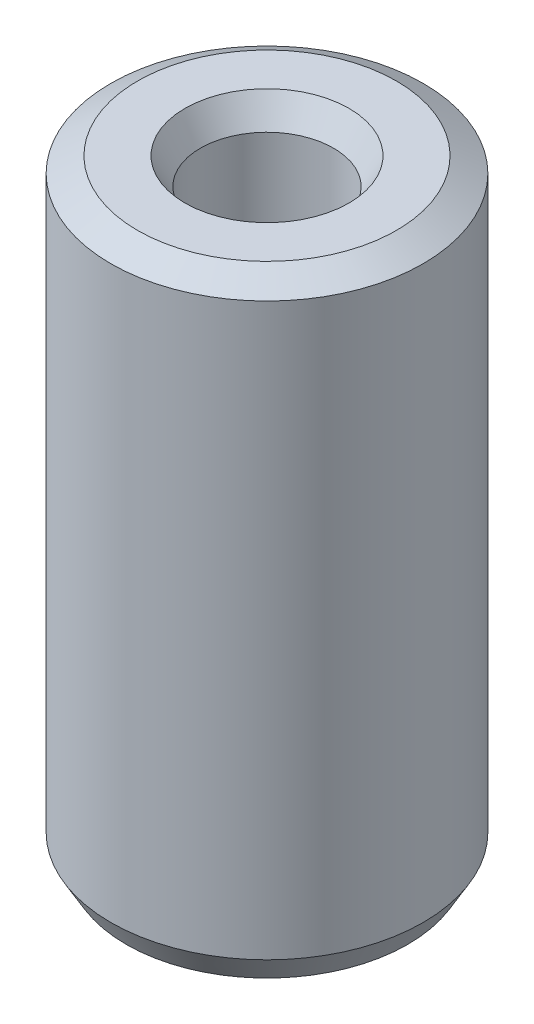
from build123d import *
from OCP.BRepFilletAPI import BRepFilletAPI_MakeChamfer

# Parameters (mm, degrees)
SKETCH1_R           = 10
BOSS_EXTRUDE1_DEPTH = 39.22732465
SKETCH2_R           = 4.26370812
CUT_EXTRUDE1_DEPTH  = 42.698716997
CHAMFER1_SIZE       = 0.988595411
CHAMFER1_SIZE2      = 1.712297479


with BuildPart() as part:
    # Sketch1 → Boss-Extrude1 (new body)
    with BuildSketch(Plane(origin=(0, 0, 0), x_dir=(1, 0, 0), z_dir=(0, 1, 0))):
        Circle(SKETCH1_R)
    extrude(amount=BOSS_EXTRUDE1_DEPTH)

    # Sketch2 → Cut-Extrude1 (cut, through all)
    with BuildSketch(Plane(origin=(0, 0, 0), x_dir=(1, 0, 0), z_dir=(0, 1, 0))):
        Circle(SKETCH2_R)
    extrude(amount=CUT_EXTRUDE1_DEPTH, mode=Mode.SUBTRACT)

    # Chamfer1: one chamfer whose edges measure the first distance from different faces: ONE call of the kernel's chamfer builder (chamfer() names one face for all edges)
    chamfer1_edges_1 = [part.edges().sort_by_distance(p)[0] for p in [
        (-4.26370812, 39.22732465, 0),
    ]]
    chamfer1_side_1 = [part.faces().sort_by_distance(p)[0] for p in [
        (-9.717157288, 39.22732465, 0),
    ]]
    chamfer1_edges_2 = [part.edges().sort_by_distance(p)[0] for p in [
        (-4.26370812, 0, 0),
    ]]
    chamfer1_side_2 = [part.faces().sort_by_distance(p)[0] for p in [
        (-4.26370812, 19.613662325, 0),
    ]]
    chamfer1_edges_3 = [part.edges().sort_by_distance(p)[0] for p in [
        (-10, 0, 0),
    ]]
    chamfer1_side_3 = [part.faces().sort_by_distance(p)[0] for p in [
        (-9.717157288, 0, 0),
    ]]
    chamfer1_edges_4 = [part.edges().sort_by_distance(p)[0] for p in [
        (-10, 39.22732465, 0),
    ]]
    chamfer1_side_4 = [part.faces().sort_by_distance(p)[0] for p in [
        (-10, 19.613662325, 0),
    ]]
    chamfer1 = BRepFilletAPI_MakeChamfer(part.part.solid().wrapped)
    for e in chamfer1_edges_1:
        chamfer1.Add(CHAMFER1_SIZE, CHAMFER1_SIZE2, e.wrapped, chamfer1_side_1[0].wrapped)  # the first distance lies on this face
    for e in chamfer1_edges_2:
        chamfer1.Add(CHAMFER1_SIZE, CHAMFER1_SIZE2, e.wrapped, chamfer1_side_2[0].wrapped)  # the first distance lies on this face
    for e in chamfer1_edges_3:
        chamfer1.Add(CHAMFER1_SIZE, CHAMFER1_SIZE2, e.wrapped, chamfer1_side_3[0].wrapped)  # the first distance lies on this face
    for e in chamfer1_edges_4:
        chamfer1.Add(CHAMFER1_SIZE, CHAMFER1_SIZE2, e.wrapped, chamfer1_side_4[0].wrapped)  # the first distance lies on this face
    add(Compound.cast(chamfer1.Shape()), mode=Mode.REPLACE)


solid = part.part
